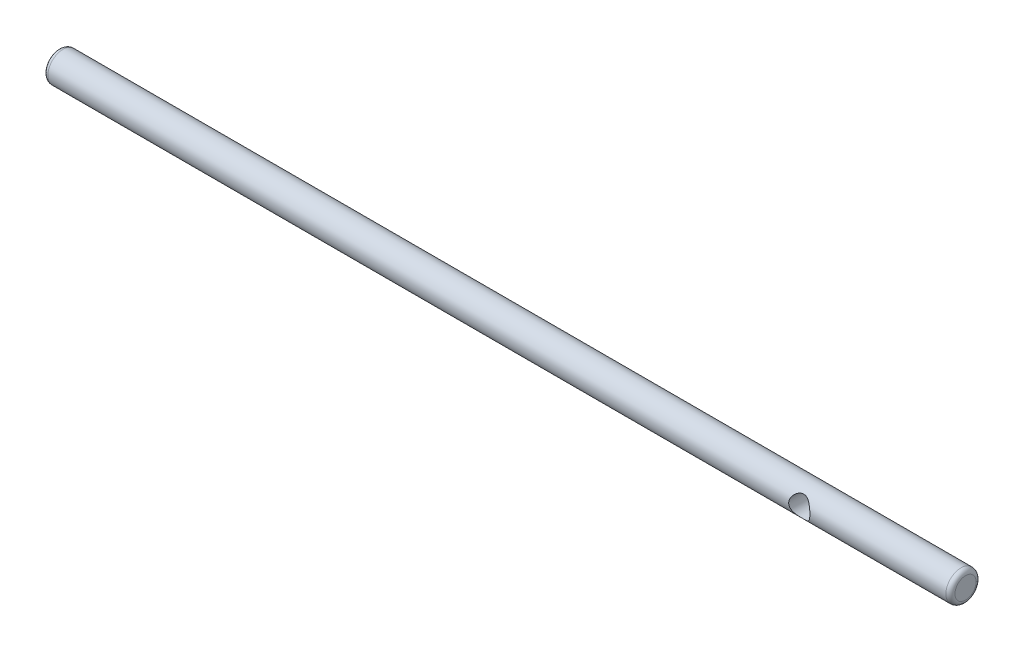
from build123d import *

# Parameters (mm, degrees)
SKIZZE1_W                        = 150
SKIZZE1_H                        = 2.5
VERRUNDUNG1_R                    = 0.75
VERRUNDUNG2_R                    = 0.75
F_3_5_3_5_DURCHMESSER_BOHRUNG1_D = 3.5


with BuildPart() as part:
    # Skizze1 → Rotation1 (revolve)
    with BuildSketch(Plane.XY):
        with Locations((-75, 1.25)):
            Rectangle(SKIZZE1_W, SKIZZE1_H)
    revolve(axis=Axis((0, 0, 0), (-1, 0, 0)))

    # Verrundung1
    verrundung1_edges = [part.edges().sort_by_distance(p)[0] for p in [
        (-150, -2.5, 0),
    ]]
    fillet(verrundung1_edges, radius=VERRUNDUNG1_R)

    # Verrundung2
    verrundung2_edges = [part.edges().sort_by_distance(p)[0] for p in [
        (0, -2.5, 0),
    ]]
    fillet(verrundung2_edges, radius=VERRUNDUNG2_R)

    # Ø3.5 (3.5) Durchmesser Bohrung1 (through all)
    with Locations(Plane(origin=(-25, 0.063040866, 2.499205043), x_dir=(0, 0.999682017384, -0.025216346285), z_dir=(0, 0.025216346285, 0.999682017384))):
        with Locations((0, 0)):
            Hole(F_3_5_3_5_DURCHMESSER_BOHRUNG1_D / 2)


solid = part.part
